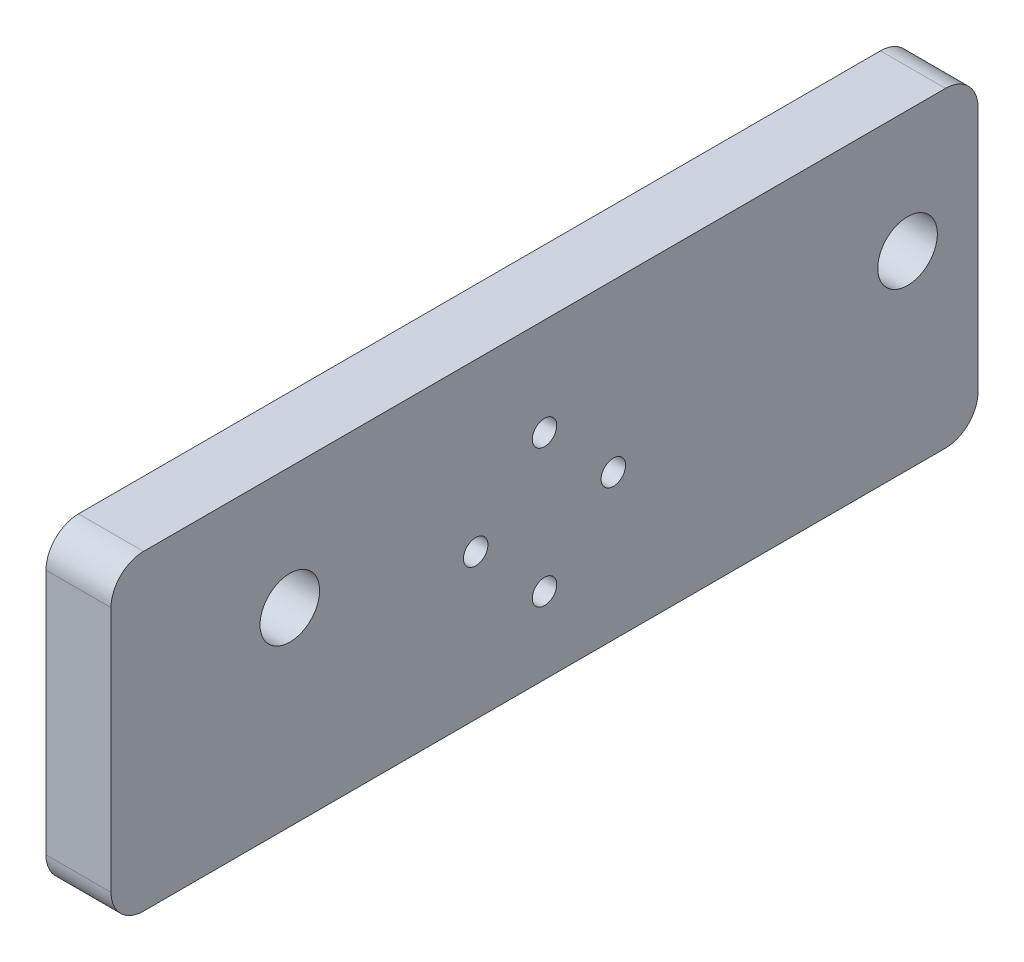
from build123d import *

# Parameters (mm, degrees)
SKETCH1_W             = 80
SKETCH1_H             = 28.75
BOSS_EXTRUDE1_DEPTH   = 6
M5_CLEARANCE_HOLE1_D  = 5.5
F_2_CLEARANCE_HOLE1_D = 2.2606
FILLET2_R             = 3


with BuildPart() as part:
    # Sketch1 → Boss-Extrude1 (new body)
    with BuildSketch(Plane(origin=(0, 0, 0), x_dir=(0, 0, -1), z_dir=(1, 0, 0))):
        Rectangle(SKETCH1_W, SKETCH1_H)
    extrude(amount=BOSS_EXTRUDE1_DEPTH)

    # M5 Clearance Hole1 (through all)
    with Locations(Plane.ZY):
        with Locations((-33.5, 3.125), (23.5, 3.125)):
            Hole(M5_CLEARANCE_HOLE1_D / 2)

    # #2 Clearance Hole1 (through all)
    with Locations(Plane.ZY):
        with Locations((-6.35, -0.975), (6.35, -0.975), (0, -7.325), (0, 5.375)):
            Hole(F_2_CLEARANCE_HOLE1_D / 2)

    # Fillet2
    fillet2_edges = [part.edges().sort_by_distance(p)[0] for p in [
        (3, -14.375, -40),
        (3, 14.375, -40),
        (3, 14.375, 40),
        (3, -14.375, 40),
    ]]
    fillet(fillet2_edges, radius=FILLET2_R)


solid = part.part
